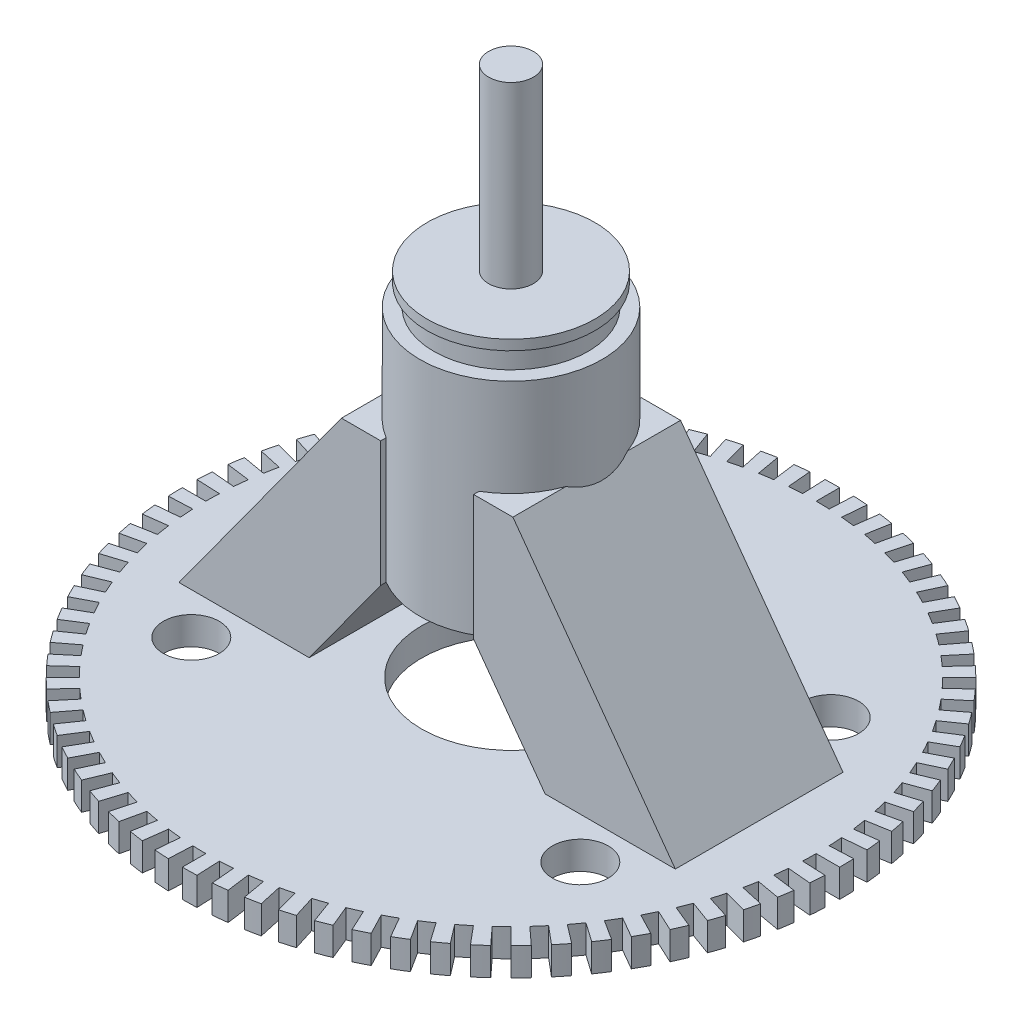
from build123d import *

# Parameters (mm, degrees)
SKETCH1_R            = 74.676
EXTRUDE1_DEPTH       = 6.35
SKETCH2_W            = 112.776
SKETCH2_H            = 38.1
EXTRUDE2_DEPTH       = 50.8
CUT_EXTRUDE2_DEPTH   = 131.160316733
CUT_EXTRUDE3_DEPTH   = 50.8
SKETCH5_W            = 21.114642828
SKETCH5_H            = 28.448
CUT_EXTRUDE4_DEPTH   = 50.8
EXTRUDE3_START       = 22.352
SKETCH6_R            = 20.701
EXTRUDE3_DEPTH       = 50.546
CUT_EXTRUDE5_REACH   = 134.035
SKETCH7_R            = 20.32
SKETCH8_R            = 17.526
EXTRUDE4_DEPTH       = 4.826
SKETCH9_R            = 19.05
EXTRUDE5_DEPTH       = 2.286
SKETCH10_R           = 5.08
EXTRUDE6_DEPTH       = 40.64
SKETCH11_R           = 6.35
CUT_EXTRUDE6_DEPTH   = 20.32
LPATTERN1_COUNT      = 2
LPATTERN1_PITCH      = 88.392
LPATTERN1_COUNT_DIR2 = 2
LPATTERN1_PITCH_DIR2 = 56.896
CUT_EXTRUDE8_START   = -20.32
CUT_EXTRUDE8_DEPTH   = 20.32
CUT_EXTRUDE9_START   = -20.32
CUT_EXTRUDE9_DEPTH   = 20.32
CIRPATTERN1_START    = -6.35
CIRPATTERN1_DEPTH    = 6.35


# Read off the part's stored shape, not the designer's step: CirPattern1
with BuildPart() as part:
    # Sketch1 → Extrude1 (new body)
    with BuildSketch(Plane(origin=(0, 0, 0), x_dir=(1, 0, 0), z_dir=(0, 1, 0))):
        with Locations(Location((0, 0, 0), (0, 0, 270))):
            Circle(SKETCH1_R)
    extrude(amount=-EXTRUDE1_DEPTH)

    # Sketch2 → Extrude2 (add)
    with BuildSketch(Plane(origin=(0, 0, 0), x_dir=(-1, 0, 0), z_dir=(0, 1, 0))):
        Rectangle(SKETCH2_W, SKETCH2_H)
    extrude(amount=EXTRUDE2_DEPTH)

    # Sketch3 → Cut-Extrude2 (cut, through all)
    with BuildSketch(Plane.XY.offset(19.05)):
        Polygon((-26.797, 0), (-10.557321414, 22.352), (10.557321414, 22.352), (26.797, 0), align=None)
    extrude(amount=-CUT_EXTRUDE2_DEPTH, mode=Mode.SUBTRACT)

    # Sketch4 → Cut-Extrude3 (cut)
    with BuildSketch(Plane.XY.offset(19.05)):
        Polygon((-56.388, 0), (-19.479639577, 50.8), (-56.388, 50.8), align=None)
        Polygon((19.479639577, 50.8), (56.388, 0), (56.388, 50.8), align=None)
    extrude(amount=-CUT_EXTRUDE3_DEPTH, mode=Mode.SUBTRACT)

    # Sketch5 → Cut-Extrude4 (cut)
    with BuildSketch(Plane.XY.offset(19.05)):
        with Locations((0, 36.576)):
            Rectangle(SKETCH5_W, SKETCH5_H)
    extrude(amount=-CUT_EXTRUDE4_DEPTH, mode=Mode.SUBTRACT)

    # Sketch6 → Extrude3 (add)
    with BuildSketch(Plane(origin=(0, 0, 0), x_dir=(-1, 0, 0), z_dir=(0, 1, 0)).offset(EXTRUDE3_START)):
        with Locations(Location((0, 0, 0), (0, 0, 239.336777068))):
            Circle(SKETCH6_R)
    extrude(amount=EXTRUDE3_DEPTH)

    # Sketch7 → Cut-Extrude5 (cut, up to next)
    with BuildSketch(Plane.XZ.offset(6.35), mode=Mode.PRIVATE) as cut_extrude5_sk1:
        with Locations(Location((0, 0, 0), (0, 0, 270))):
            Circle(SKETCH7_R)
    cut_extrude5_tool1 = extrude(cut_extrude5_sk1.sketch, amount=-CUT_EXTRUDE5_REACH, mode=Mode.PRIVATE) & part.part
    add(cut_extrude5_tool1.solids().sort_by_distance((0, -6.35, 0))[0], mode=Mode.SUBTRACT)

    # Sketch8 → Extrude4 (add)
    with BuildSketch(Plane(origin=(0, 72.898, 0), x_dir=(-1, 0, 0), z_dir=(0, 1, 0))):
        with Locations(Location((0, 0, 0), (0, 0, 90))):
            Circle(SKETCH8_R)
    extrude(amount=EXTRUDE4_DEPTH)

    # Sketch9 → Extrude5 (add)
    with BuildSketch(Plane(origin=(0, 77.724, 0), x_dir=(-1, 0, 0), z_dir=(0, 1, 0))):
        with Locations(Location((0, 0, 0), (0, 0, 90))):
            Circle(SKETCH9_R)
    extrude(amount=EXTRUDE5_DEPTH)

    # Sketch10 → Extrude6 (add)
    with BuildSketch(Plane(origin=(0, 80.01, 0), x_dir=(-1, 0, 0), z_dir=(0, 1, 0))):
        with Locations(Location((0, 0, 0), (0, 0, 90))):
            Circle(SKETCH10_R)
    extrude(amount=EXTRUDE6_DEPTH)

    # Sketch11 → Cut-Extrude6 (cut)
    with BuildSketch(Plane(origin=(0, 0, 0), x_dir=(-1, 0, 0), z_dir=(0, 1, 0))):
        with Locations(Location((-44.196, 28.448, 0), (0, 0, 90))):
            Circle(SKETCH11_R)
    cut_extrude6 = extrude(amount=-CUT_EXTRUDE6_DEPTH, mode=Mode.SUBTRACT)

    # LPattern1: Cut-Extrude6 2 × 2
    with Locations(*[(-i * LPATTERN1_PITCH, 0, -j * LPATTERN1_PITCH_DIR2) for i in range(LPATTERN1_COUNT) for j in range(LPATTERN1_COUNT_DIR2) if (i, j) != (0, 0)]):
        add(cut_extrude6, mode=Mode.SUBTRACT)

    # Sketch16 → Cut-Extrude8 (cut)
    with BuildSketch(Plane.XZ.offset(6.35).offset(CUT_EXTRUDE8_START)):
        with BuildLine():
            ThreePointArc((-3.024655559, 69.276001781), (-1.512687758, 69.325498482), (0, 69.342))
            Line((0, 69.342), (0, 74.676))
            ThreePointArc((0, 74.676), (-1.629048355, 74.658229134), (-3.257321371, 74.604924995))
            Line((-3.257321371, 74.604924995), (-3.024655559, 69.276001781))
        make_face()
    extrude(amount=CUT_EXTRUDE8_DEPTH, mode=Mode.SUBTRACT)

    # Sketch18 → Cut-Extrude9 (cut)
    with BuildSketch(Plane.XZ.offset(6.35).offset(CUT_EXTRUDE9_START)):
        with BuildLine():
            Line((3.257321371, 74.604924995), (3.024655559, 69.276001781))
            ThreePointArc((3.024655559, 69.276001781), (4.535183787, 69.193533455), (6.043553514, 69.078132755))
            Line((6.043553514, 69.078132755), (6.508442245, 74.391835275))
            ThreePointArc((6.508442245, 74.391835275), (4.884044078, 74.516112952), (3.257321371, 74.604924995))
        make_face()
    extrude(amount=CUT_EXTRUDE9_DEPTH, mode=Mode.SUBTRACT)

    # CirPattern1 outline → CirPattern1 (cut)
    with BuildSketch(Plane(origin=(0, 0, 0), x_dir=(1, 0, 0), z_dir=(0, 1, 0)).offset(CIRPATTERN1_START)):
        with BuildLine():
            Line((-6.508442245, -74.391835275), (-6.043553514, -69.078132755))
            ThreePointArc((-6.043553514, -69.078132755), (-7.549046836, -68.929854605), (-9.050947221, -68.748769577))
            Line((-9.050947221, -68.748769577), (-9.74717393, -74.037136468))
            ThreePointArc((-9.74717393, -74.037136468), (-8.129742746, -74.232151113), (-6.508442245, -74.391835275))
        make_face()
        with BuildLine():
            ThreePointArc((9.74717393, -74.037136468), (11.359965987, -73.806884156), (12.967351315, -73.541503764))
            Line((12.967351315, -73.541503764), (12.041111936, -68.288539209))
            ThreePointArc((12.041111936, -68.288539209), (10.548539845, -68.534963859), (9.050947221, -68.748769577))
            Line((9.050947221, -68.748769577), (9.74717393, -74.037136468))
        make_face()
        with BuildLine():
            ThreePointArc((16.16284461, -72.905880628), (17.749431695, -72.535940406), (19.327571012, -72.131477004))
            Line((19.327571012, -72.131477004), (17.947030225, -66.979228647))
            ThreePointArc((17.947030225, -66.979228647), (16.481615146, -67.354801805), (15.00835571, -67.698317726))
            Line((15.00835571, -67.698317726), (16.16284461, -72.905880628))
        make_face()
        with BuildLine():
            ThreePointArc((22.455506284, -71.219767014), (24.003813511, -70.712954351), (25.540696223, -70.17248615))
            Line((25.540696223, -70.17248615), (23.716360778, -65.160165711))
            ThreePointArc((23.716360778, -65.160165711), (22.289255402, -65.662029039), (20.851541549, -66.132640799))
            Line((20.851541549, -66.132640799), (22.455506284, -71.219767014))
        make_face()
        with BuildLine():
            ThreePointArc((28.577267995, -68.99162797), (30.075511812, -68.351800015), (31.559441314, -67.679440305))
            Line((31.559441314, -67.679440305), (29.305195506, -62.845194569))
            ThreePointArc((29.305195506, -62.845194569), (27.927260968, -63.469528585), (26.536034567, -64.063654543))
            Line((26.536034567, -64.063654543), (28.577267995, -68.99162797))
        make_face()
        with BuildLine():
            ThreePointArc((34.481539442, -66.238420979), (35.918317308, -65.47044721), (37.338, -64.671313053))
            Line((37.338, -64.671313053), (34.671, -60.051933549))
            ThreePointArc((34.671, -60.051933549), (33.352723214, -60.793986694), (32.018572339, -61.507105194))
            Line((32.018572339, -61.507105194), (34.481539442, -66.238420979))
        make_face()
        with BuildLine():
            ThreePointArc((40.123385553, -62.981099608), (41.487762721, -62.090824769), (42.832393961, -61.17099806))
            Line((42.832393961, -61.17099806), (39.772937249, -56.801641055))
            ThreePointArc((39.772937249, -56.801641055), (38.524351098, -57.655765856), (37.257429442, -58.482449636))
            Line((37.257429442, -58.482449636), (40.123385553, -62.981099608))
        make_face()
        with BuildLine():
            ThreePointArc((45.459868473, -59.24445404), (46.741461209, -58.23865366), (48.000807542, -57.205134835))
            Line((48.000807542, -57.205134835), (44.572178431, -53.119053775))
            ThreePointArc((44.572178431, -53.119053775), (43.402785408, -54.078749827), (42.21273501, -55.012707322))
            Line((42.21273501, -55.012707322), (45.459868473, -59.24445404))
        make_face()
        with BuildLine():
            ThreePointArc((50.450374344, -55.056922404), (51.639428954, -53.943251231), (52.803905992, -52.803905992))
            Line((52.803905992, -52.803905992), (49.032198421, -49.032198421))
            ThreePointArc((49.032198421, -49.032198421), (47.950898314, -50.090161857), (46.846776176, -51.124285089))
            Line((46.846776176, -51.124285089), (50.450374344, -55.056922404))
        make_face()
        with BuildLine():
            ThreePointArc((55.056922404, -50.450374344), (56.144389464, -49.237308089), (57.205134835, -48.000807542))
            Line((57.205134835, -48.000807542), (53.119053775, -44.572178431))
            ThreePointArc((53.119053775, -44.572178431), (52.13407593, -45.720357511), (51.124285089, -46.846776176))
            Line((51.124285089, -46.846776176), (55.056922404, -50.450374344))
        make_face()
        with BuildLine():
            ThreePointArc((59.24445404, -45.459868473), (60.222057269, -44.156639302), (61.17099806, -42.832393962))
            Line((61.17099806, -42.832393962), (56.801641055, -39.772937249))
            ThreePointArc((56.801641055, -39.772937249), (55.920481749, -41.002593637), (55.012707322, -42.21273501))
            Line((55.012707322, -42.21273501), (59.24445404, -45.459868473))
        make_face()
        with BuildLine():
            ThreePointArc((62.981099608, -40.123385553), (63.841398855, -38.739911827), (64.671313054, -37.338))
            Line((64.671313054, -37.338), (60.051933549, -34.671))
            ThreePointArc((60.051933549, -34.671), (59.281298936, -35.972775267), (58.482449636, -37.257429442))
            Line((58.482449636, -37.257429442), (62.981099608, -40.123385553))
        make_face()
        with BuildLine():
            ThreePointArc((66.238420979, -34.481539443), (66.974868847, -33.028350231), (67.679440305, -31.559441314))
            Line((67.679440305, -31.559441314), (62.845194569, -29.305195506))
            ThreePointArc((62.845194569, -29.305195506), (62.190949643, -30.669182357), (61.507105194, -32.018572339))
            Line((61.507105194, -32.018572339), (66.238420979, -34.481539443))
        make_face()
        with BuildLine():
            ThreePointArc((68.991627971, -28.577267995), (69.598619647, -27.065422947), (70.172486151, -25.540696223))
            Line((70.172486151, -25.540696223), (65.160165711, -23.716360778))
            ThreePointArc((65.160165711, -23.716360778), (64.627289672, -25.132178451), (64.063654543, -26.536034567))
            Line((64.063654543, -26.536034567), (68.991627971, -28.577267995))
        make_face()
        with BuildLine():
            ThreePointArc((71.219767015, -22.455506284), (71.692682927, -20.896511452), (72.131477005, -19.327571012))
            Line((72.131477005, -19.327571012), (66.979228647, -17.947030225))
            ThreePointArc((66.979228647, -17.947030225), (66.571777003, -19.403903491), (66.132640799, -20.851541549))
            Line((66.132640799, -20.851541549), (71.219767015, -22.455506284))
        make_face()
        with BuildLine():
            ThreePointArc((72.905880629, -16.16284461), (73.2411216, -14.568564887), (73.541503765, -12.967351315))
            Line((73.541503765, -12.967351315), (68.288539209, -12.041111936))
            ThreePointArc((68.288539209, -12.041111936), (68.009612914, -13.52795311), (67.698317726, -15.00835571))
            Line((67.698317726, -15.00835571), (72.905880629, -16.16284461))
        make_face()
        with BuildLine():
            ThreePointArc((74.037136469, -9.74717393), (74.232151114, -8.129742746), (74.391835276, -6.508442245))
            Line((74.391835276, -6.508442245), (69.078132755, -6.043553514))
            ThreePointArc((69.078132755, -6.043553514), (68.929854605, -7.549046836), (68.748769577, -9.050947221))
            Line((68.748769577, -9.050947221), (74.037136469, -9.74717393))
        make_face()
        with BuildLine():
            ThreePointArc((74.604924996, -3.257321371), (74.658229135, -1.629048355), (74.676000001, 0))
            Line((74.676000001, 0), (69.342, 0))
            ThreePointArc((69.342, 0), (69.325498482, -1.512687758), (69.276001781, -3.024655559))
            Line((69.276001781, -3.024655559), (74.604924996, -3.257321371))
        make_face()
        with BuildLine():
            ThreePointArc((74.604924996, 3.257321371), (74.516112953, 4.884044078), (74.391835276, 6.508442245))
            Line((74.391835276, 6.508442245), (69.078132755, 6.043553514))
            ThreePointArc((69.078132755, 6.043553514), (69.193533455, 4.535183787), (69.276001781, 3.024655559))
            Line((69.276001781, 3.024655559), (74.604924996, 3.257321371))
        make_face()
        with BuildLine():
            ThreePointArc((74.037136469, 9.74717393), (73.806884156, 11.359965987), (73.541503765, 12.967351315))
            Line((73.541503765, 12.967351315), (68.288539209, 12.041111936))
            ThreePointArc((68.288539209, 12.041111936), (68.534963859, 10.548539845), (68.748769577, 9.050947221))
            Line((68.748769577, 9.050947221), (74.037136469, 9.74717393))
        make_face()
        with BuildLine():
            ThreePointArc((72.905880629, 16.16284461), (72.535940406, 17.749431695), (72.131477005, 19.327571012))
            Line((72.131477005, 19.327571012), (66.979228647, 17.947030225))
            ThreePointArc((66.979228647, 17.947030225), (67.354801805, 16.481615146), (67.698317726, 15.00835571))
            Line((67.698317726, 15.00835571), (72.905880629, 16.16284461))
        make_face()
        with BuildLine():
            ThreePointArc((71.219767015, 22.455506284), (70.712954351, 24.003813511), (70.17248615, 25.540696223))
            Line((70.17248615, 25.540696223), (65.160165711, 23.716360778))
            ThreePointArc((65.160165711, 23.716360778), (65.662029039, 22.289255402), (66.132640799, 20.851541549))
            Line((66.132640799, 20.851541549), (71.219767015, 22.455506284))
        make_face()
        with BuildLine():
            ThreePointArc((68.991627971, 28.577267995), (68.351800015, 30.075511812), (67.679440305, 31.559441314))
            Line((67.679440305, 31.559441314), (62.845194569, 29.305195506))
            ThreePointArc((62.845194569, 29.305195506), (63.469528585, 27.927260968), (64.063654543, 26.536034567))
            Line((64.063654543, 26.536034567), (68.991627971, 28.577267995))
        make_face()
        with BuildLine():
            ThreePointArc((66.238420979, 34.481539442), (65.47044721, 35.918317308), (64.671313054, 37.338))
            Line((64.671313054, 37.338), (60.051933549, 34.671))
            ThreePointArc((60.051933549, 34.671), (60.793986694, 33.352723214), (61.507105194, 32.018572339))
            Line((61.507105194, 32.018572339), (66.238420979, 34.481539442))
        make_face()
        with BuildLine():
            ThreePointArc((62.981099608, 40.123385553), (62.090824769, 41.487762721), (61.17099806, 42.832393961))
            Line((61.17099806, 42.832393961), (56.801641055, 39.772937249))
            ThreePointArc((56.801641055, 39.772937249), (57.655765856, 38.524351098), (58.482449636, 37.257429442))
            Line((58.482449636, 37.257429442), (62.981099608, 40.123385553))
        make_face()
        with BuildLine():
            ThreePointArc((59.24445404, 45.459868473), (58.23865366, 46.741461209), (57.205134835, 48.000807541))
            Line((57.205134835, 48.000807541), (53.119053775, 44.572178431))
            ThreePointArc((53.119053775, 44.572178431), (54.078749827, 43.402785408), (55.012707322, 42.21273501))
            Line((55.012707322, 42.21273501), (59.24445404, 45.459868473))
        make_face()
        with BuildLine():
            ThreePointArc((55.056922404, 50.450374344), (53.943251231, 51.639428954), (52.803905992, 52.803905992))
            Line((52.803905992, 52.803905992), (49.032198421, 49.032198421))
            ThreePointArc((49.032198421, 49.032198421), (50.090161857, 47.950898314), (51.124285089, 46.846776176))
            Line((51.124285089, 46.846776176), (55.056922404, 50.450374344))
        make_face()
        with BuildLine():
            ThreePointArc((50.450374344, 55.056922404), (49.237308089, 56.144389464), (48.000807541, 57.205134834))
            Line((48.000807541, 57.205134834), (44.572178431, 53.119053775))
            ThreePointArc((44.572178431, 53.119053775), (45.720357511, 52.13407593), (46.846776176, 51.124285089))
            Line((46.846776176, 51.124285089), (50.450374344, 55.056922404))
        make_face()
        with BuildLine():
            ThreePointArc((45.459868473, 59.24445404), (44.156639301, 60.222057268), (42.832393961, 61.170998059))
            Line((42.832393961, 61.170998059), (39.772937249, 56.801641055))
            ThreePointArc((39.772937249, 56.801641055), (41.002593637, 55.920481749), (42.21273501, 55.012707322))
            Line((42.21273501, 55.012707322), (45.459868473, 59.24445404))
        make_face()
        with BuildLine():
            ThreePointArc((40.123385553, 62.981099608), (38.739911826, 63.841398855), (37.338, 64.671313053))
            Line((37.338, 64.671313053), (34.671, 60.051933549))
            ThreePointArc((34.671, 60.051933549), (35.972775267, 59.281298936), (37.257429442, 58.482449636))
            Line((37.257429442, 58.482449636), (40.123385553, 62.981099608))
        make_face()
        with BuildLine():
            ThreePointArc((34.481539442, 66.238420978), (33.028350231, 66.974868847), (31.559441314, 67.679440305))
            Line((31.559441314, 67.679440305), (29.305195506, 62.845194569))
            ThreePointArc((29.305195506, 62.845194569), (30.669182357, 62.190949643), (32.018572339, 61.507105194))
            Line((32.018572339, 61.507105194), (34.481539442, 66.238420978))
        make_face()
        with BuildLine():
            ThreePointArc((28.577267995, 68.99162797), (27.065422947, 69.598619647), (25.540696223, 70.17248615))
            Line((25.540696223, 70.17248615), (23.716360778, 65.160165711))
            ThreePointArc((23.716360778, 65.160165711), (25.132178451, 64.627289672), (26.536034567, 64.063654543))
            Line((26.536034567, 64.063654543), (28.577267995, 68.99162797))
        make_face()
        with BuildLine():
            ThreePointArc((22.455506284, 71.219767014), (20.896511452, 71.692682926), (19.327571012, 72.131477004))
            Line((19.327571012, 72.131477004), (17.947030225, 66.979228647))
            ThreePointArc((17.947030225, 66.979228647), (19.403903491, 66.571777003), (20.851541549, 66.132640799))
            Line((20.851541549, 66.132640799), (22.455506284, 71.219767014))
        make_face()
        with BuildLine():
            ThreePointArc((16.16284461, 72.905880628), (14.568564886, 73.241121599), (12.967351315, 73.541503764))
            Line((12.967351315, 73.541503764), (12.041111936, 68.288539209))
            ThreePointArc((12.041111936, 68.288539209), (13.52795311, 68.009612914), (15.00835571, 67.698317726))
            Line((15.00835571, 67.698317726), (16.16284461, 72.905880628))
        make_face()
        with BuildLine():
            ThreePointArc((9.74717393, 74.037136468), (8.129742746, 74.232151113), (6.508442245, 74.391835275))
            Line((6.508442245, 74.391835275), (6.043553514, 69.078132755))
            ThreePointArc((6.043553514, 69.078132755), (7.549046836, 68.929854605), (9.050947221, 68.748769577))
            Line((9.050947221, 68.748769577), (9.74717393, 74.037136468))
        make_face()
        with BuildLine():
            ThreePointArc((3.257321371, 74.604924995), (1.629048355, 74.658229134), (0, 74.676))
            Line((0, 74.676), (0, 69.342))
            ThreePointArc((0, 69.342), (1.512687758, 69.325498482), (3.024655559, 69.276001781))
            Line((3.024655559, 69.276001781), (3.257321371, 74.604924995))
        make_face()
        with BuildLine():
            ThreePointArc((-3.257321371, 74.604924995), (-4.884044078, 74.516112952), (-6.508442245, 74.391835274))
            Line((-6.508442245, 74.391835274), (-6.043553514, 69.078132755))
            ThreePointArc((-6.043553514, 69.078132755), (-4.535183787, 69.193533455), (-3.024655559, 69.276001781))
            Line((-3.024655559, 69.276001781), (-3.257321371, 74.604924995))
        make_face()
        with BuildLine():
            ThreePointArc((-9.74717393, 74.037136468), (-11.359965987, 73.806884155), (-12.967351315, 73.541503764))
            Line((-12.967351315, 73.541503764), (-12.041111936, 68.288539209))
            ThreePointArc((-12.041111936, 68.288539209), (-10.548539845, 68.534963859), (-9.050947221, 68.748769577))
            Line((-9.050947221, 68.748769577), (-9.74717393, 74.037136468))
        make_face()
        with BuildLine():
            ThreePointArc((-16.16284461, 72.905880627), (-17.749431695, 72.535940405), (-19.327571012, 72.131477004))
            Line((-19.327571012, 72.131477004), (-17.947030225, 66.979228647))
            ThreePointArc((-17.947030225, 66.979228647), (-16.481615146, 67.354801805), (-15.00835571, 67.698317726))
            Line((-15.00835571, 67.698317726), (-16.16284461, 72.905880627))
        make_face()
        with BuildLine():
            ThreePointArc((-22.455506284, 71.219767014), (-24.003813511, 70.71295435), (-25.540696223, 70.172486149))
            Line((-25.540696223, 70.172486149), (-23.716360778, 65.160165711))
            ThreePointArc((-23.716360778, 65.160165711), (-22.289255402, 65.662029039), (-20.851541549, 66.132640799))
            Line((-20.851541549, 66.132640799), (-22.455506284, 71.219767014))
        make_face()
        with BuildLine():
            ThreePointArc((-28.577267995, 68.991627969), (-30.075511812, 68.351800014), (-31.559441314, 67.679440304))
            Line((-31.559441314, 67.679440304), (-29.305195506, 62.845194569))
            ThreePointArc((-29.305195506, 62.845194569), (-27.927260968, 63.469528585), (-26.536034567, 64.063654543))
            Line((-26.536034567, 64.063654543), (-28.577267995, 68.991627969))
        make_face()
        with BuildLine():
            ThreePointArc((-34.481539442, 66.238420978), (-35.918317308, 65.470447209), (-37.338, 64.671313053))
            Line((-37.338, 64.671313053), (-34.671, 60.051933549))
            ThreePointArc((-34.671, 60.051933549), (-33.352723214, 60.793986694), (-32.018572339, 61.507105194))
            Line((-32.018572339, 61.507105194), (-34.481539442, 66.238420978))
        make_face()
        with BuildLine():
            ThreePointArc((-40.123385552, 62.981099607), (-41.487762721, 62.090824768), (-42.832393961, 61.170998059))
            Line((-42.832393961, 61.170998059), (-39.772937249, 56.801641055))
            ThreePointArc((-39.772937249, 56.801641055), (-38.524351098, 57.655765856), (-37.257429442, 58.482449636))
            Line((-37.257429442, 58.482449636), (-40.123385552, 62.981099607))
        make_face()
        with BuildLine():
            ThreePointArc((-45.459868472, 59.244454039), (-46.741461209, 58.238653659), (-48.000807541, 57.205134834))
            Line((-48.000807541, 57.205134834), (-44.572178431, 53.119053775))
            ThreePointArc((-44.572178431, 53.119053775), (-43.402785408, 54.078749827), (-42.21273501, 55.012707322))
            Line((-42.21273501, 55.012707322), (-45.459868472, 59.244454039))
        make_face()
        with BuildLine():
            ThreePointArc((-50.450374343, 55.056922403), (-51.639428953, 53.94325123), (-52.803905991, 52.803905991))
            Line((-52.803905991, 52.803905991), (-49.032198421, 49.032198421))
            ThreePointArc((-49.032198421, 49.032198421), (-47.950898314, 50.090161857), (-46.846776176, 51.124285089))
            Line((-46.846776176, 51.124285089), (-50.450374343, 55.056922403))
        make_face()
        with BuildLine():
            ThreePointArc((-55.056922403, 50.450374343), (-56.144389463, 49.237308088), (-57.205134834, 48.000807541))
            Line((-57.205134834, 48.000807541), (-53.119053775, 44.572178431))
            ThreePointArc((-53.119053775, 44.572178431), (-52.13407593, 45.720357511), (-51.124285089, 46.846776176))
            Line((-51.124285089, 46.846776176), (-55.056922403, 50.450374343))
        make_face()
        with BuildLine():
            ThreePointArc((-59.244454039, 45.459868472), (-60.222057268, 44.156639301), (-61.170998059, 42.832393961))
            Line((-61.170998059, 42.832393961), (-56.801641055, 39.772937249))
            ThreePointArc((-56.801641055, 39.772937249), (-55.920481749, 41.002593637), (-55.012707322, 42.21273501))
            Line((-55.012707322, 42.21273501), (-59.244454039, 45.459868472))
        make_face()
        with BuildLine():
            ThreePointArc((-62.981099607, 40.123385552), (-63.841398854, 38.739911826), (-64.671313052, 37.338))
            Line((-64.671313052, 37.338), (-60.051933549, 34.671))
            ThreePointArc((-60.051933549, 34.671), (-59.281298936, 35.972775267), (-58.482449636, 37.257429442))
            Line((-58.482449636, 37.257429442), (-62.981099607, 40.123385552))
        make_face()
        with BuildLine():
            ThreePointArc((-66.238420978, 34.481539442), (-66.974868846, 33.028350231), (-67.679440304, 31.559441314))
            Line((-67.679440304, 31.559441314), (-62.845194569, 29.305195506))
            ThreePointArc((-62.845194569, 29.305195506), (-62.190949643, 30.669182357), (-61.507105194, 32.018572339))
            Line((-61.507105194, 32.018572339), (-66.238420978, 34.481539442))
        make_face()
        with BuildLine():
            ThreePointArc((-68.991627969, 28.577267995), (-69.598619646, 27.065422946), (-70.172486149, 25.540696223))
            Line((-70.172486149, 25.540696223), (-65.160165711, 23.716360778))
            ThreePointArc((-65.160165711, 23.716360778), (-64.627289672, 25.132178451), (-64.063654543, 26.536034567))
            Line((-64.063654543, 26.536034567), (-68.991627969, 28.577267995))
        make_face()
        with BuildLine():
            ThreePointArc((-71.219767013, 22.455506284), (-71.692682925, 20.896511452), (-72.131477003, 19.327571012))
            Line((-72.131477003, 19.327571012), (-66.979228647, 17.947030225))
            ThreePointArc((-66.979228647, 17.947030225), (-66.571777003, 19.403903491), (-66.132640799, 20.851541549))
            Line((-66.132640799, 20.851541549), (-71.219767013, 22.455506284))
        make_face()
        with BuildLine():
            ThreePointArc((-72.905880627, 16.16284461), (-73.241121599, 14.568564886), (-73.541503763, 12.967351315))
            Line((-73.541503763, 12.967351315), (-68.288539209, 12.041111936))
            ThreePointArc((-68.288539209, 12.041111936), (-68.009612914, 13.52795311), (-67.698317726, 15.00835571))
            Line((-67.698317726, 15.00835571), (-72.905880627, 16.16284461))
        make_face()
        with BuildLine():
            ThreePointArc((-74.037136467, 9.74717393), (-74.232151112, 8.129742746), (-74.391835274, 6.508442245))
            Line((-74.391835274, 6.508442245), (-69.078132755, 6.043553514))
            ThreePointArc((-69.078132755, 6.043553514), (-68.929854605, 7.549046836), (-68.748769577, 9.050947221))
            Line((-68.748769577, 9.050947221), (-74.037136467, 9.74717393))
        make_face()
        with BuildLine():
            ThreePointArc((-74.604924994, 3.257321371), (-74.658229133, 1.629048355), (-74.675999999, 0))
            Line((-74.675999999, 0), (-69.342, 0))
            ThreePointArc((-69.342, 0), (-69.325498482, 1.512687758), (-69.276001781, 3.024655559))
            Line((-69.276001781, 3.024655559), (-74.604924994, 3.257321371))
        make_face()
        with BuildLine():
            ThreePointArc((-74.604924994, -3.257321371), (-74.516112951, -4.884044078), (-74.391835274, -6.508442245))
            Line((-74.391835274, -6.508442245), (-69.078132755, -6.043553514))
            ThreePointArc((-69.078132755, -6.043553514), (-69.193533455, -4.535183787), (-69.276001781, -3.024655559))
            Line((-69.276001781, -3.024655559), (-74.604924994, -3.257321371))
        make_face()
        with BuildLine():
            ThreePointArc((-74.037136467, -9.74717393), (-73.806884155, -11.359965987), (-73.541503763, -12.967351315))
            Line((-73.541503763, -12.967351315), (-68.288539209, -12.041111936))
            ThreePointArc((-68.288539209, -12.041111936), (-68.534963859, -10.548539845), (-68.748769577, -9.050947221))
            Line((-68.748769577, -9.050947221), (-74.037136467, -9.74717393))
        make_face()
        with BuildLine():
            ThreePointArc((-72.905880627, -16.16284461), (-72.535940405, -17.749431695), (-72.131477003, -19.327571012))
            Line((-72.131477003, -19.327571012), (-66.979228647, -17.947030225))
            ThreePointArc((-66.979228647, -17.947030225), (-67.354801805, -16.481615146), (-67.698317726, -15.00835571))
            Line((-67.698317726, -15.00835571), (-72.905880627, -16.16284461))
        make_face()
        with BuildLine():
            ThreePointArc((-71.219767013, -22.455506284), (-70.712954349, -24.003813511), (-70.172486149, -25.540696223))
            Line((-70.172486149, -25.540696223), (-65.160165711, -23.716360778))
            ThreePointArc((-65.160165711, -23.716360778), (-65.662029039, -22.289255402), (-66.132640799, -20.851541549))
            Line((-66.132640799, -20.851541549), (-71.219767013, -22.455506284))
        make_face()
        with BuildLine():
            ThreePointArc((-68.991627969, -28.577267995), (-68.351800014, -30.075511812), (-67.679440304, -31.559441314))
            Line((-67.679440304, -31.559441314), (-62.845194569, -29.305195506))
            ThreePointArc((-62.845194569, -29.305195506), (-63.469528585, -27.927260968), (-64.063654543, -26.536034567))
            Line((-64.063654543, -26.536034567), (-68.991627969, -28.577267995))
        make_face()
        with BuildLine():
            ThreePointArc((-66.238420978, -34.481539442), (-65.470447209, -35.918317308), (-64.671313052, -37.338))
            Line((-64.671313052, -37.338), (-60.051933549, -34.671))
            ThreePointArc((-60.051933549, -34.671), (-60.793986694, -33.352723214), (-61.507105194, -32.018572339))
            Line((-61.507105194, -32.018572339), (-66.238420978, -34.481539442))
        make_face()
        with BuildLine():
            ThreePointArc((-62.981099607, -40.123385552), (-62.090824768, -41.487762721), (-61.170998059, -42.832393961))
            Line((-61.170998059, -42.832393961), (-56.801641055, -39.772937249))
            ThreePointArc((-56.801641055, -39.772937249), (-57.655765856, -38.524351098), (-58.482449636, -37.257429442))
            Line((-58.482449636, -37.257429442), (-62.981099607, -40.123385552))
        make_face()
        with BuildLine():
            ThreePointArc((-59.244454039, -45.459868472), (-58.238653659, -46.741461209), (-57.205134834, -48.000807541))
            Line((-57.205134834, -48.000807541), (-53.119053775, -44.572178431))
            ThreePointArc((-53.119053775, -44.572178431), (-54.078749827, -43.402785408), (-55.012707322, -42.21273501))
            Line((-55.012707322, -42.21273501), (-59.244454039, -45.459868472))
        make_face()
        with BuildLine():
            ThreePointArc((-55.056922403, -50.450374343), (-53.943251231, -51.639428953), (-52.803905992, -52.803905992))
            Line((-52.803905992, -52.803905992), (-49.032198421, -49.032198421))
            ThreePointArc((-49.032198421, -49.032198421), (-50.090161857, -47.950898314), (-51.124285089, -46.846776176))
            Line((-51.124285089, -46.846776176), (-55.056922403, -50.450374343))
        make_face()
        with BuildLine():
            ThreePointArc((-50.450374344, -55.056922403), (-49.237308088, -56.144389463), (-48.000807541, -57.205134834))
            Line((-48.000807541, -57.205134834), (-44.572178431, -53.119053775))
            ThreePointArc((-44.572178431, -53.119053775), (-45.720357511, -52.13407593), (-46.846776176, -51.124285089))
            Line((-46.846776176, -51.124285089), (-50.450374344, -55.056922403))
        make_face()
        with BuildLine():
            ThreePointArc((-45.459868472, -59.244454039), (-44.156639301, -60.222057268), (-42.832393961, -61.170998059))
            Line((-42.832393961, -61.170998059), (-39.772937249, -56.801641055))
            ThreePointArc((-39.772937249, -56.801641055), (-41.002593637, -55.920481749), (-42.21273501, -55.012707322))
            Line((-42.21273501, -55.012707322), (-45.459868472, -59.244454039))
        make_face()
        with BuildLine():
            ThreePointArc((-40.123385553, -62.981099607), (-38.739911826, -63.841398854), (-37.338, -64.671313053))
            Line((-37.338, -64.671313053), (-34.671, -60.051933549))
            ThreePointArc((-34.671, -60.051933549), (-35.972775267, -59.281298936), (-37.257429442, -58.482449636))
            Line((-37.257429442, -58.482449636), (-40.123385553, -62.981099607))
        make_face()
        with BuildLine():
            ThreePointArc((-34.481539442, -66.238420978), (-33.028350231, -66.974868846), (-31.559441314, -67.679440305))
            Line((-31.559441314, -67.679440305), (-29.305195506, -62.845194569))
            ThreePointArc((-29.305195506, -62.845194569), (-30.669182357, -62.190949643), (-32.018572339, -61.507105194))
            Line((-32.018572339, -61.507105194), (-34.481539442, -66.238420978))
        make_face()
        with BuildLine():
            ThreePointArc((-28.577267995, -68.99162797), (-27.065422947, -69.598619647), (-25.540696223, -70.17248615))
            Line((-25.540696223, -70.17248615), (-23.716360778, -65.160165711))
            ThreePointArc((-23.716360778, -65.160165711), (-25.132178451, -64.627289672), (-26.536034567, -64.063654543))
            Line((-26.536034567, -64.063654543), (-28.577267995, -68.99162797))
        make_face()
        with BuildLine():
            ThreePointArc((-22.455506284, -71.219767014), (-20.896511452, -71.692682926), (-19.327571012, -72.131477004))
            Line((-19.327571012, -72.131477004), (-17.947030225, -66.979228647))
            ThreePointArc((-17.947030225, -66.979228647), (-19.403903491, -66.571777003), (-20.851541549, -66.132640799))
            Line((-20.851541549, -66.132640799), (-22.455506284, -71.219767014))
        make_face()
        with BuildLine():
            ThreePointArc((-16.16284461, -72.905880628), (-14.568564886, -73.2411216), (-12.967351315, -73.541503764))
            Line((-12.967351315, -73.541503764), (-12.041111936, -68.288539209))
            ThreePointArc((-12.041111936, -68.288539209), (-13.52795311, -68.009612914), (-15.00835571, -67.698317726))
            Line((-15.00835571, -67.698317726), (-16.16284461, -72.905880628))
        make_face()
    extrude(amount=CIRPATTERN1_DEPTH, mode=Mode.SUBTRACT)


solid = part.part
